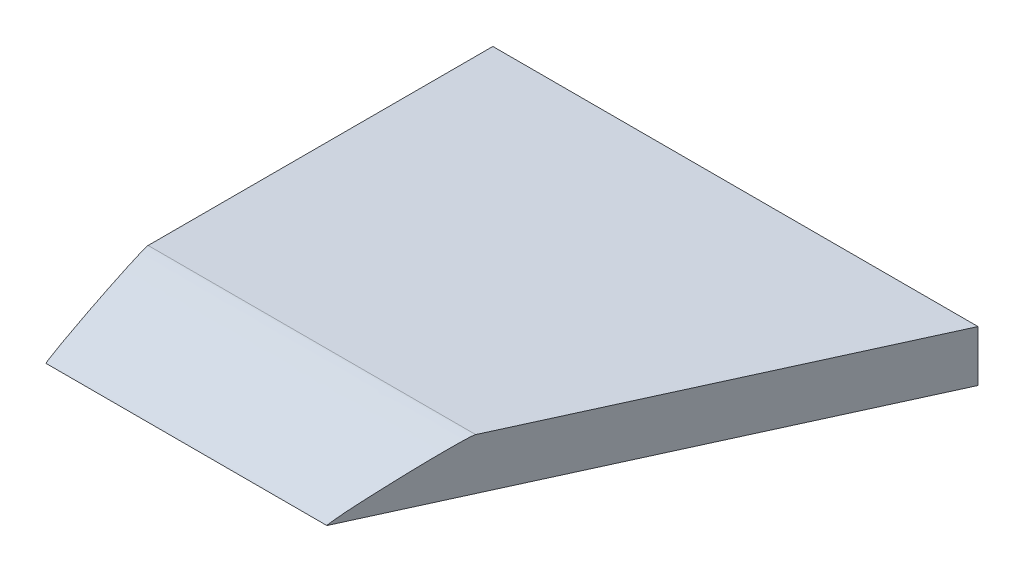
from build123d import *

# Parameters (mm, degrees)
RESSALTO_EXTRUS_O1_DEPTH = 4
FILETE1_DEPTH            = 38


with BuildPart() as part:
    # Esboço1 → Ressalto-extrusão1 (new body)
    with BuildSketch(Plane(origin=(0, 0, 0), x_dir=(1, 0, 0), z_dir=(0, 1, 0))):
        Polygon((0, 0), (38, 0), (22, -35), (0, -35), align=None)
    extrude(amount=RESSALTO_EXTRUS_O1_DEPTH)

    # Filete1: read off the stored shape, not the designer's step
    # Filete1 outline → Filete1 (cut)
    with BuildSketch(Plane.YZ):
        with BuildLine():
            Line((4, 35), (0, 35))
            add(Edge.make_bspline(
                [(0, 35), (4, 32), (4, 27)],
                knots=[0, 0, 0, 1, 1, 1], degree=2, weights=[1, 0.089442719, 1]))
            Line((4, 27), (4, 35))
        make_face()
    extrude(amount=FILETE1_DEPTH, mode=Mode.SUBTRACT)


solid = part.part
